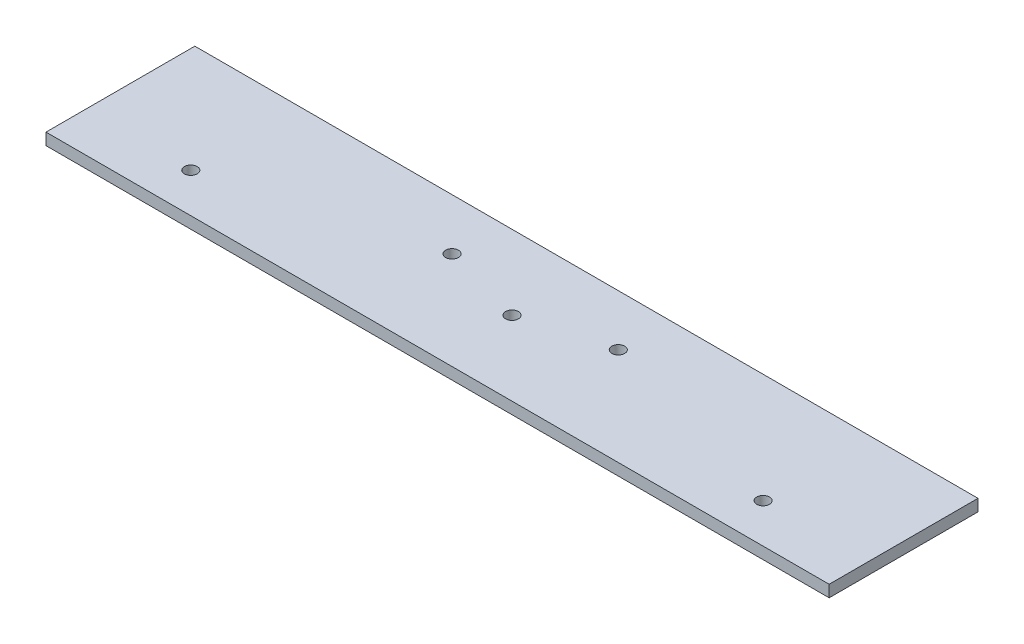
from build123d import *

# Parameters (mm, degrees)
SKETCH1_W           = 194.300874916
SKETCH1_H           = 36.931173376
SKETCH1_R           = 1.5875
BOSS_EXTRUDE1_DEPTH = 1.4605


with BuildPart() as part:
    # Sketch1 → Boss-Extrude1 (new, symmetric)
    with BuildSketch(Plane(origin=(0, 0, 0), x_dir=(1, 0, 0), z_dir=(0, 1, 0))):
        Rectangle(SKETCH1_W, SKETCH1_H)
        with Locations((-71, -8.695)):
            Circle(SKETCH1_R, mode=Mode.SUBTRACT)
        with Locations((71, -8.695)):
            Circle(SKETCH1_R, mode=Mode.SUBTRACT)
        Circle(SKETCH1_R, mode=Mode.SUBTRACT)
        with Locations((-20.62, 5.75)):
            Circle(SKETCH1_R, mode=Mode.SUBTRACT)
        with Locations((20.62, 5.75)):
            Circle(SKETCH1_R, mode=Mode.SUBTRACT)
    extrude(amount=BOSS_EXTRUDE1_DEPTH, both=True)


solid = part.part
